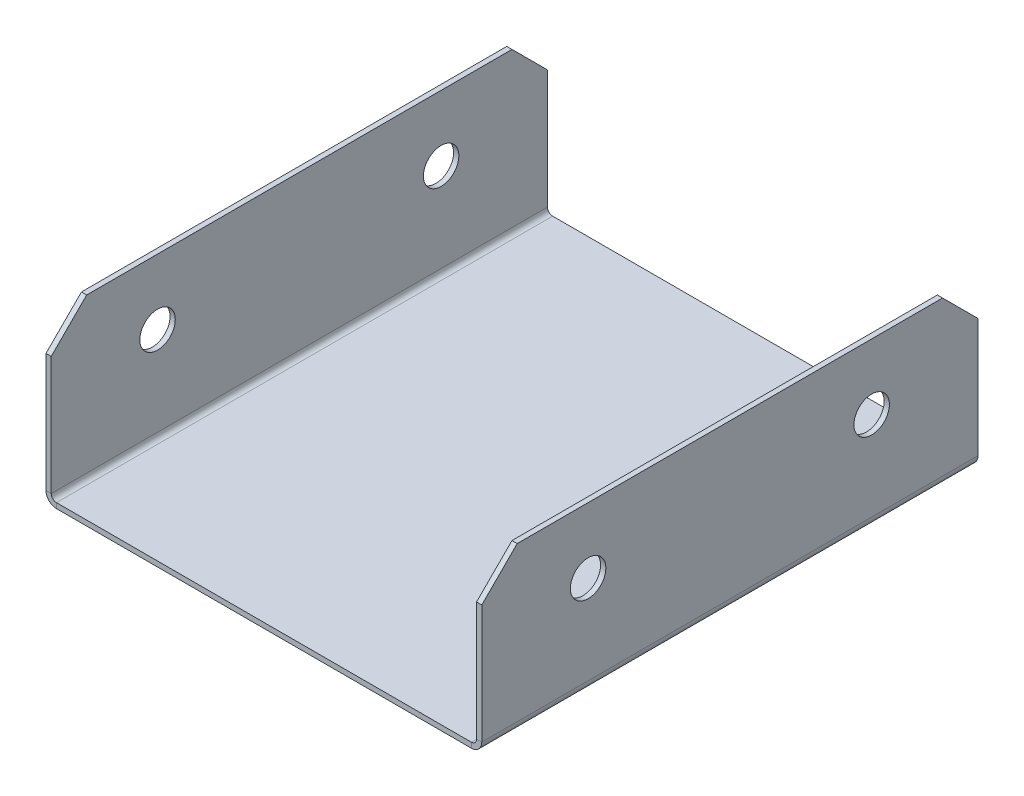
from build123d import *

# Parameters (mm, degrees)
SM_BASE_FLANGE_1_DEPTH   = 70
CUT_EXTRUDE_1_DEPTH      = 80.693089911
CUT_EXTRUDE_1_DEPTH_BACK = 80.693089911
SKETCH_6_R               = 2.5
CHAMFER_1_SIZE           = 5


# Sheet-metal steps are written as plain solids
with BuildPart() as part:
    # Sketch 1 → 基材-凸緣1 (new body)
    with BuildSketch(Plane.XY):
        with BuildLine():
            Line((-30, 22.5), (-30, 0.7366))
            ThreePointArc((-30, 0.7366), (-29.784254855, 0.215745145), (-29.2634, 0))
            Line((-29.2634, 0), (29.2634, 0))
            ThreePointArc((29.2634, 0), (29.784254855, 0.215745145), (30, 0.7366))
            Line((30, 0.7366), (30, 22.5))
            Line((30, 22.5), (30.7366, 22.5))
            Line((30.7366, 22.5), (30.7366, 0.7366))
            ThreePointArc((30.7366, 0.7366), (30.30510971, -0.30510971), (29.2634, -0.7366))
            Line((29.2634, -0.7366), (-29.2634, -0.7366))
            ThreePointArc((-29.2634, -0.7366), (-30.30510971, -0.30510971), (-30.7366, 0.7366))
            Line((-30.7366, 0.7366), (-30.7366, 22.5))
            Line((-30.7366, 22.5), (-30, 22.5))
        make_face()
    extrude(amount=SM_BASE_FLANGE_1_DEPTH)

    # 草圖6 → 除料-伸長1 (cut, two sides: drawn at the far end of the back side and taken through both)
    with BuildSketch(Plane(origin=(0, 0, 0), x_dir=(0, 0, -1), z_dir=(1, 0, 0)).offset(-CUT_EXTRUDE_1_DEPTH_BACK)):
        with Locations((-15, 13.2634)):
            Circle(SKETCH_6_R)
        with Locations((-55, 13.2634)):
            Circle(SKETCH_6_R)
    extrude(amount=CUT_EXTRUDE_1_DEPTH + CUT_EXTRUDE_1_DEPTH_BACK, mode=Mode.SUBTRACT)

    # 導角1
    chamfer_1_edges = [part.edges().sort_by_distance(p)[0] for p in [
        (-30.3683, 22.5, 0),
        (30.3683, 22.5, 0),
        (-30.3683, 22.5, 70),
        (30.3683, 22.5, 70),
    ]]
    chamfer(chamfer_1_edges, length=CHAMFER_1_SIZE)


solid = part.part
